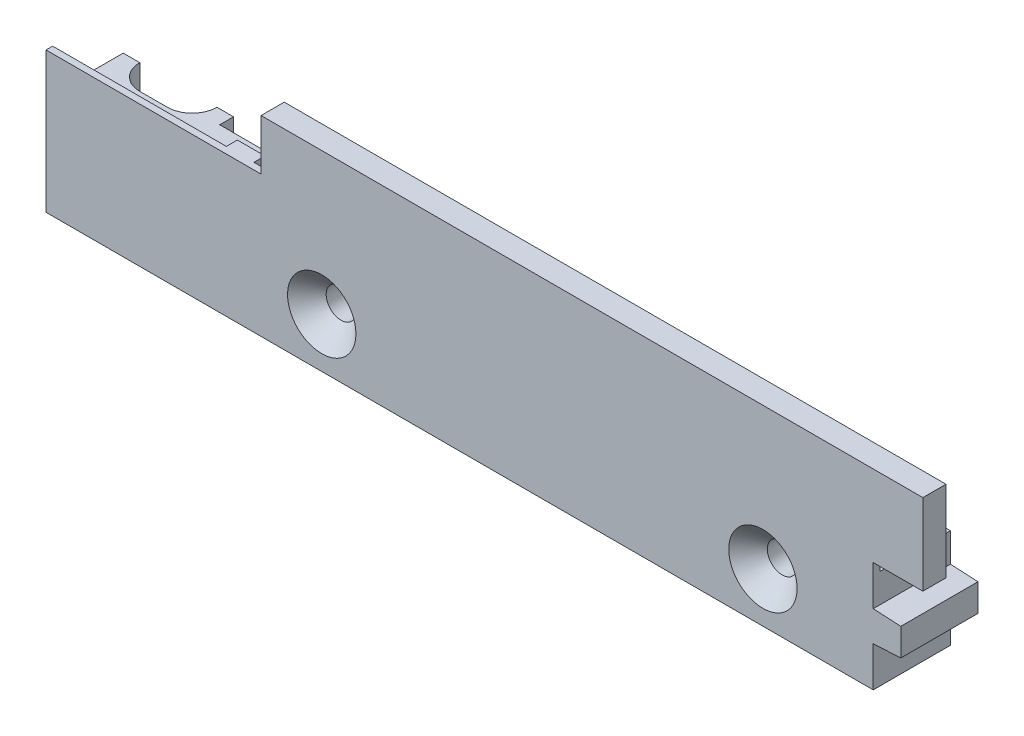
from build123d import *
from OCP.BRepFilletAPI import BRepFilletAPI_MakeChamfer

# Parameters (mm, degrees)
BOSS_EXTRUDE1_DEPTH      = 14
BOSS_EXTRUDE1_DEPTH_BACK = 14
CUT_EXTRUDE1_DEPTH       = 157
CUT_EXTRUDE4_DEPTH       = 2.5
CUT_EXTRUDE4_DEPTH_BACK  = 2.5
SKETCH8_W                = 125
SKETCH8_H                = 34.7
CUT_EXTRUDE5_DEPTH       = 131.960317585
CUT_EXTRUDE5_DEPTH_BACK  = 131.960317585
SKETCH9_R                = 2.7
CHAMFER2_SIZE            = 5
CHAMFER2_SIZE_2          = 0.262038896
CUT_EXTRUDE8_DEPTH       = 7
CUT_EXTRUDE9_DEPTH       = 131.749429849
SKETCH16_W               = 214.344642296
SKETCH16_H               = 84.645654919
CUT_EXTRUDE10_DEPTH      = 131.960317585
SKETCH17_W               = 2
SKETCH17_H               = 14.7
CUT_EXTRUDE11_DEPTH      = 9.8
SKETCH18_R               = 1.35
CUT_EXTRUDE12_DEPTH      = 3
CHAMFER7_SIZE            = 3.5
SKETCH19_W               = 5
SKETCH19_H               = 7.5
BOSS_EXTRUDE2_DEPTH      = 2


with BuildPart() as part:
    # Sketch1 → Boss-Extrude1 (new, two sides: drawn at the far end of the back side and taken through both)
    with BuildSketch(Plane.XY.offset(-BOSS_EXTRUDE1_DEPTH_BACK)):
        Polygon((-127.819104229, -9.862903226), (22.180895771, -9.862903226), (22.180895771, -2.612903226), (27.180895771, -2.612903226), (27.180895771, 2.887096774), (22.180895771, 2.887096774), (22.180895771, 10.137096774), (31.180895771, 10.137096774), (31.180895771, 23.637096774), (31.180895771, 24.837096774), (-88.819104229, 24.837096774), (-88.819104229, 23.637096774), (-88.819104229, 15.637096774), (-127.819104229, 15.637096774), align=None)
    extrude(amount=BOSS_EXTRUDE1_DEPTH + BOSS_EXTRUDE1_DEPTH_BACK)

    # Sketch2 → Cut-Extrude1 (cut)
    with BuildSketch(Plane.ZY.offset(127.819104229)):
        Polygon((-12.8, 23.137096774), (-12.8, 8.137096774), (12.8, 8.137096774), (12.8, 23.137096774), (9.8, 23.137096774), (9.8, 24.837096774), (-9.8, 24.837096774), (-9.8, 23.137096774), align=None)
    extrude(amount=-CUT_EXTRUDE1_DEPTH, mode=Mode.SUBTRACT)

    # Sketch8 → Cut-Extrude4 (cut, two sides: drawn at the far end of the back side and taken through both)
    with BuildSketch(Plane.XY.offset(-CUT_EXTRUDE4_DEPTH_BACK)):
        with Locations((-45.319104229, 7.487096774)):
            Rectangle(SKETCH8_W, SKETCH8_H)
    extrude(amount=CUT_EXTRUDE4_DEPTH + CUT_EXTRUDE4_DEPTH_BACK, mode=Mode.SUBTRACT)

    # Sketch9 → Cut-Extrude5 (cut, two sides: drawn at the far end of the back side and taken through both)
    with BuildSketch(Plane.XY.offset(-CUT_EXTRUDE5_DEPTH_BACK)):
        with Locations((-77.819104229, -0.862903226)):
            Circle(SKETCH9_R)
        with Locations((2.180895771, -0.862903226)):
            Circle(SKETCH9_R)
    extrude(amount=CUT_EXTRUDE5_DEPTH + CUT_EXTRUDE5_DEPTH_BACK, mode=Mode.SUBTRACT)

    # Chamfer2
    chamfer2_edges_1 = [part.edges().sort_by_distance(p)[0] for p in [
        (27.180895771, -2.612903226, 0),
    ]]
    chamfer2_side_1 = [part.faces().sort_by_distance(p)[0] for p in [
        (27.175654993, -2.612903226, 0),
    ]]
    chamfer2_edges_2 = [part.edges().sort_by_distance(p)[0] for p in [
        (27.180895771, 2.887096774, 0),
    ]]
    chamfer2_side_2 = [part.faces().sort_by_distance(p)[0] for p in [
        (27.180895771, 2.881855996, 0),
    ]]
    chamfer2 = BRepFilletAPI_MakeChamfer(part.part.solid().wrapped)
    for e in chamfer2_edges_1:
        chamfer2.Add(CHAMFER2_SIZE - 0.0001, CHAMFER2_SIZE_2 - 0.0001, e.wrapped, chamfer2_side_1[0].wrapped)
    for e in chamfer2_edges_2:
        chamfer2.Add(CHAMFER2_SIZE_2 - 0.0001, CHAMFER2_SIZE - 0.0001, e.wrapped, chamfer2_side_2[0].wrapped)
    add(Compound.cast(chamfer2.Shape()), mode=Mode.REPLACE)  # a hair under: the kernel refuses the full size

    # Sketch14 → Cut-Extrude8 (cut)
    with BuildSketch(Plane(origin=(0, 8.137096774, 0), x_dir=(1, 0, 0), z_dir=(0, 1, 0))):
        with BuildLine():
            Line((-120.319104229, 4.5), (-115.319104229, 4.5))
            ThreePointArc((-115.319104229, 4.5), (-110.819104229, 0), (-115.319104229, -4.5))
            Line((-115.319104229, -4.5), (-120.319104229, -4.5))
            ThreePointArc((-120.319104229, -4.5), (-124.819104229, 0), (-120.319104229, 4.5))
        make_face()
    extrude(amount=-CUT_EXTRUDE8_DEPTH, mode=Mode.SUBTRACT)

    # Sketch15 → Cut-Extrude9 (cut, through all)
    with BuildSketch(Plane(origin=(0, 1.137096774, 0), x_dir=(1, 0, 0), z_dir=(0, 1, 0))):
        with BuildLine():
            Line((-120.319104229, -2.6), (-115.319104229, -2.6))
            ThreePointArc((-115.319104229, -2.6), (-112.719104229, 0), (-115.319104229, 2.6))
            Line((-115.319104229, 2.6), (-120.319104229, 2.6))
            ThreePointArc((-120.319104229, 2.6), (-122.919104229, 0), (-120.319104229, -2.6))
        make_face()
    extrude(amount=-CUT_EXTRUDE9_DEPTH, mode=Mode.SUBTRACT)

    # Sketch16 → Cut-Extrude10 (cut, through all)
    with BuildSketch(Plane.XY):
        with Locations((-30.272765953, 16.776086779)):
            Rectangle(SKETCH16_W, SKETCH16_H)
    extrude(amount=-CUT_EXTRUDE10_DEPTH, mode=Mode.SUBTRACT)

    # Sketch17 → Cut-Extrude11 (cut)
    with BuildSketch(Plane(origin=(0, 0, 0), x_dir=(-1, 0, 0), z_dir=(0, 0, -1))):
        with Locations((-30.180895771, 17.487096774)):
            Rectangle(SKETCH17_W, SKETCH17_H)
    extrude(amount=-CUT_EXTRUDE11_DEPTH, mode=Mode.SUBTRACT)

    # Sketch18 → Cut-Extrude12 (cut)
    with BuildSketch(Plane(origin=(0, 0, 0), x_dir=(-1, 0, 0), z_dir=(0, 0, -1))):
        with Locations((110.319104229, -4.362903226)):
            Circle(SKETCH18_R)
        with Locations((125.319104229, -4.362903226)):
            Circle(SKETCH18_R)
        with Locations((-22.180895771, 0.137096774)):
            Circle(SKETCH18_R)
    extrude(amount=-CUT_EXTRUDE12_DEPTH, mode=Mode.SUBTRACT)

    # Chamfer7
    chamfer7_edges = [part.edges().sort_by_distance(p)[0] for p in [
        (-80.519104229, -0.862903226, 14),
        (-0.519104229, -0.862903226, 14),
    ]]
    chamfer(chamfer7_edges, length=CHAMFER7_SIZE)

    # Sketch19 → Boss-Extrude2 (add)
    with BuildSketch(Plane(origin=(0, 0, 12.8), x_dir=(-1, 0, 0), z_dir=(0, 0, -1))):
        with Locations((93.819104229, 11.887096774)):
            Rectangle(SKETCH19_W, SKETCH19_H)
    extrude(amount=BOSS_EXTRUDE2_DEPTH)


solid = part.part
